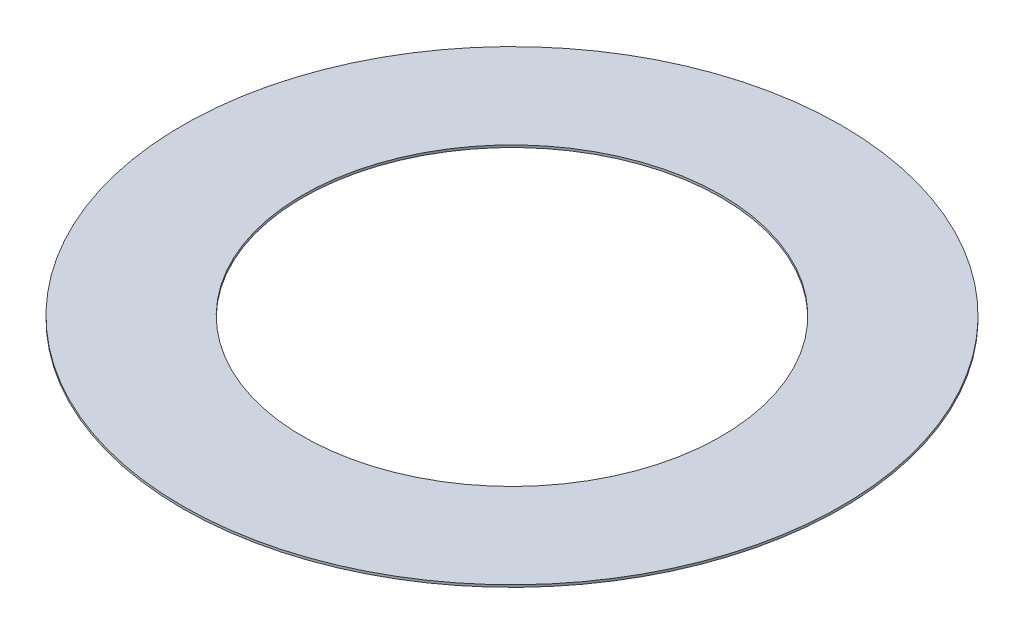
from build123d import *

# Parameters (mm, degrees)
SKETCH1_W = 40
SKETCH1_H = 0.76


with BuildPart() as part:
    # Sketch1 → Revolve1 (revolve)
    with BuildSketch(Plane.XY):
        with Locations((-89.5, 13.29)):
            Rectangle(SKETCH1_W, SKETCH1_H)
    revolve(axis=Axis((0, -200069.047495165, 0), (0, 1, 0)))


solid = part.part
